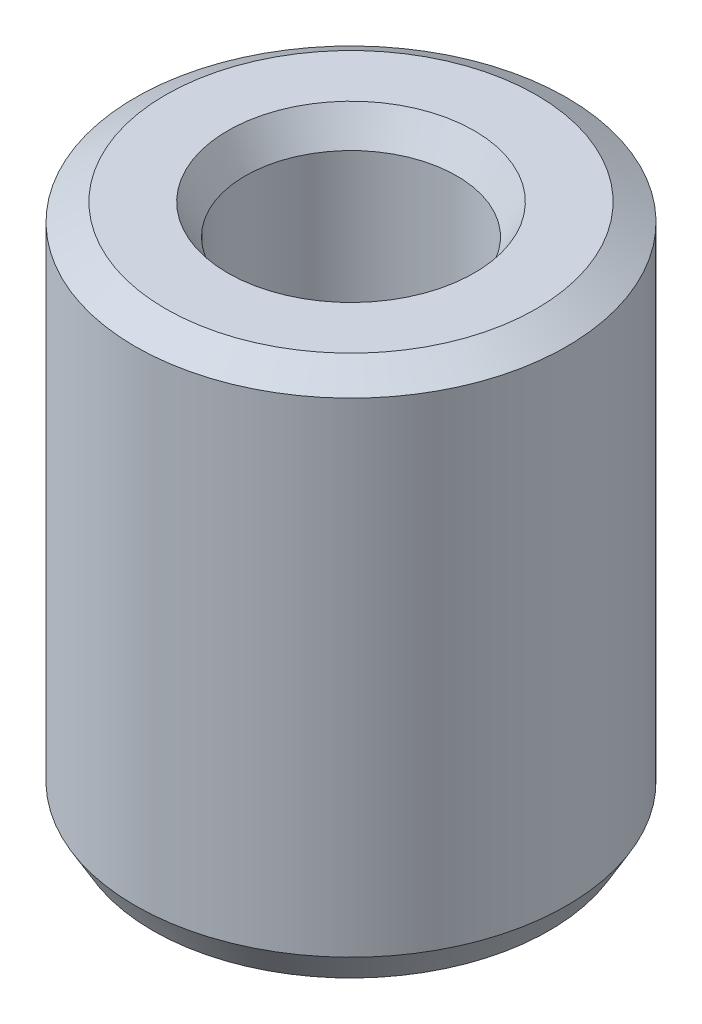
from build123d import *
from OCP.BRepFilletAPI import BRepFilletAPI_MakeChamfer

# Parameters (mm, degrees)
SKETCH1_R           = 30
BOSS_EXTRUDE1_DEPTH = 74.006515405
SKETCH2_R           = 14.710829559
CUT_EXTRUDE1_DEPTH  = 86.305124831
CHAMFER1_SIZE       = 2.437220368
CHAMFER1_SIZE2      = 4.221389506


with BuildPart() as part:
    # Sketch1 → Boss-Extrude1 (new body)
    with BuildSketch(Plane(origin=(0, 0, 0), x_dir=(1, 0, 0), z_dir=(0, 1, 0))):
        Circle(SKETCH1_R)
    extrude(amount=BOSS_EXTRUDE1_DEPTH)

    # Sketch2 → Cut-Extrude1 (cut, through all)
    with BuildSketch(Plane(origin=(0, 0, 0), x_dir=(1, 0, 0), z_dir=(0, 1, 0))):
        Circle(SKETCH2_R)
    extrude(amount=CUT_EXTRUDE1_DEPTH, mode=Mode.SUBTRACT)

    # Chamfer1: one chamfer whose edges measure the first distance from different faces: ONE call of the kernel's chamfer builder (chamfer() names one face for all edges)
    chamfer1_edges_1 = [part.edges().sort_by_distance(p)[0] for p in [
        (-14.710829559, 74.006515405, 0),
    ]]
    chamfer1_side_1 = [part.faces().sort_by_distance(p)[0] for p in [
        (-29.151471863, 74.006515405, 0),
    ]]
    chamfer1_edges_2 = [part.edges().sort_by_distance(p)[0] for p in [
        (-14.710829559, 0, 0),
    ]]
    chamfer1_side_2 = [part.faces().sort_by_distance(p)[0] for p in [
        (-14.710829559, 37.003257702, 0),
    ]]
    chamfer1_edges_3 = [part.edges().sort_by_distance(p)[0] for p in [
        (-30, 0, 0),
    ]]
    chamfer1_side_3 = [part.faces().sort_by_distance(p)[0] for p in [
        (-29.151471863, 0, 0),
    ]]
    chamfer1_edges_4 = [part.edges().sort_by_distance(p)[0] for p in [
        (-30, 74.006515405, 0),
    ]]
    chamfer1_side_4 = [part.faces().sort_by_distance(p)[0] for p in [
        (-30, 37.003257702, 0),
    ]]
    chamfer1 = BRepFilletAPI_MakeChamfer(part.part.solid().wrapped)
    for e in chamfer1_edges_1:
        chamfer1.Add(CHAMFER1_SIZE, CHAMFER1_SIZE2, e.wrapped, chamfer1_side_1[0].wrapped)  # the first distance lies on this face
    for e in chamfer1_edges_2:
        chamfer1.Add(CHAMFER1_SIZE, CHAMFER1_SIZE2, e.wrapped, chamfer1_side_2[0].wrapped)  # the first distance lies on this face
    for e in chamfer1_edges_3:
        chamfer1.Add(CHAMFER1_SIZE, CHAMFER1_SIZE2, e.wrapped, chamfer1_side_3[0].wrapped)  # the first distance lies on this face
    for e in chamfer1_edges_4:
        chamfer1.Add(CHAMFER1_SIZE, CHAMFER1_SIZE2, e.wrapped, chamfer1_side_4[0].wrapped)  # the first distance lies on this face
    add(Compound.cast(chamfer1.Shape()), mode=Mode.REPLACE)


solid = part.part
